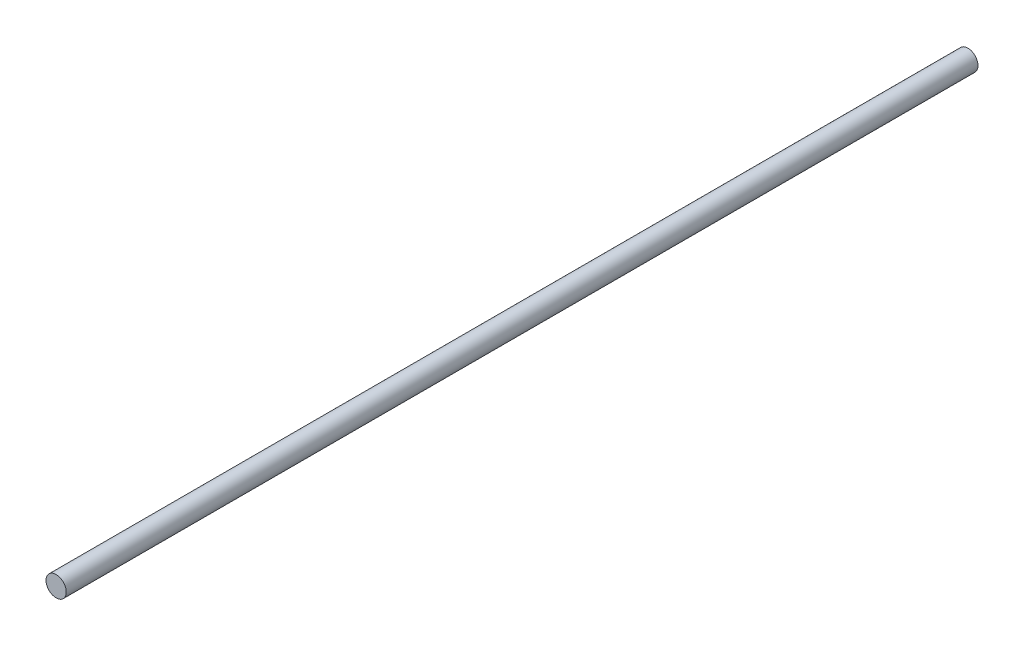
from build123d import *

# Parameters (mm, degrees)
ESBO_O1_R                = 4
RESSALTO_EXTRUS_O1_DEPTH = 360


with BuildPart() as part:
    # Esboço1 → Ressalto-extrusão1 (new body)
    with BuildSketch(Plane.XY):
        Circle(ESBO_O1_R)
    extrude(amount=RESSALTO_EXTRUS_O1_DEPTH)


solid = part.part
